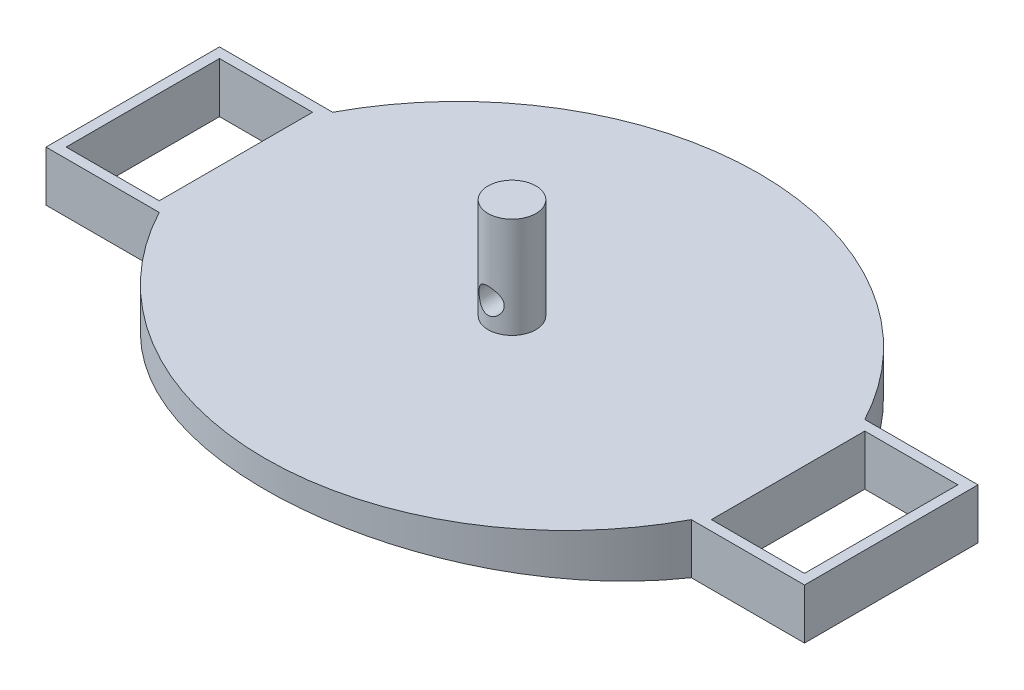
from build123d import *

# Parameters (mm, degrees)
SKETCH4_W           = 18.488801297
SKETCH4_H           = 30.46096825
BOSS_EXTRUDE3_DEPTH = 10
SKETCH5_R           = 4.75
BOSS_EXTRUDE4_DEPTH = 20
CUT_EXTRUDE1_REACH  = 99.306
SKETCH6_R           = 2.5
CUT_EXTRUDE2_REACH  = 129.264


with BuildPart() as part:
    # Sketch4 → Boss-Extrude3 (new body)
    with BuildSketch(Plane(origin=(0, 0, 0), x_dir=(1, 0, 0), z_dir=(0, 1, 0))):
        with BuildLine():
            Line((52.840693816, -62.117160098), (75.329495113, -62.117160098))
            Line((75.329495113, -62.117160098), (75.329495113, -27.656191848))
            Line((75.329495113, -27.656191848), (52.840693816, -27.656191848))
            ThreePointArc((52.840693816, -27.656191848), (0, 4.158390265), (-52.840693816, -27.656191848))
            Line((-52.840693816, -27.656191848), (-75.329495113, -27.656191848))
            Line((-75.329495113, -27.656191848), (-75.329495113, -62.117160098))
            Line((-75.329495113, -62.117160098), (-52.840693816, -62.117160098))
            ThreePointArc((-52.840693816, -62.117160098), (0, -93.931742211), (52.840693816, -62.117160098))
        make_face()
        with Locations((64.085094465, -44.886675973)):
            Rectangle(SKETCH4_W, SKETCH4_H, mode=Mode.SUBTRACT)
        with Locations((-64.085094465, -44.886675973)):
            Rectangle(SKETCH4_W, SKETCH4_H, mode=Mode.SUBTRACT)
    extrude(amount=BOSS_EXTRUDE3_DEPTH)

    # Sketch5 → Boss-Extrude4 (add)
    with BuildSketch(Plane(origin=(0, 10, 0), x_dir=(1, 0, 0), z_dir=(0, 1, 0))):
        with Locations((0, -44.886675973)):
            Circle(SKETCH5_R)
    extrude(amount=BOSS_EXTRUDE4_DEPTH)

    # Sketch6 → Cut-Extrude1 (cut, up to next)
    with BuildSketch(Plane(origin=(0, 0, 40.136675973), x_dir=(-1, 0, 0), z_dir=(0, 0, -1)), mode=Mode.PRIVATE) as cut_extrude1_sk1:
        with Locations((0, 15)):
            Circle(SKETCH6_R)
    cut_extrude1_tool1 = extrude(cut_extrude1_sk1.sketch, amount=-CUT_EXTRUDE1_REACH, mode=Mode.PRIVATE) & part.part
    add(cut_extrude1_tool1.solids().sort_by_distance((0, 15, 40.136676))[0], mode=Mode.SUBTRACT)

    # Sketch7 → Cut-Extrude2 (cut, up to next)
    with BuildSketch(Plane.XY.offset(93.931742211), mode=Mode.PRIVATE) as cut_extrude2_sk1:
        with BuildLine():
            Line((-52.840693816, 0), (52.840693816, 0))
            ThreePointArc((52.840693816, 0), (0, 4.639468143), (-52.840693816, 0))
        make_face()
    cut_extrude2_tool1 = extrude(cut_extrude2_sk1.sketch, amount=-CUT_EXTRUDE2_REACH, mode=Mode.PRIVATE) & part.part
    add(cut_extrude2_tool1.solids().sort_by_distance((0, 1.85701, 93.931742))[0], mode=Mode.SUBTRACT)


solid = part.part
